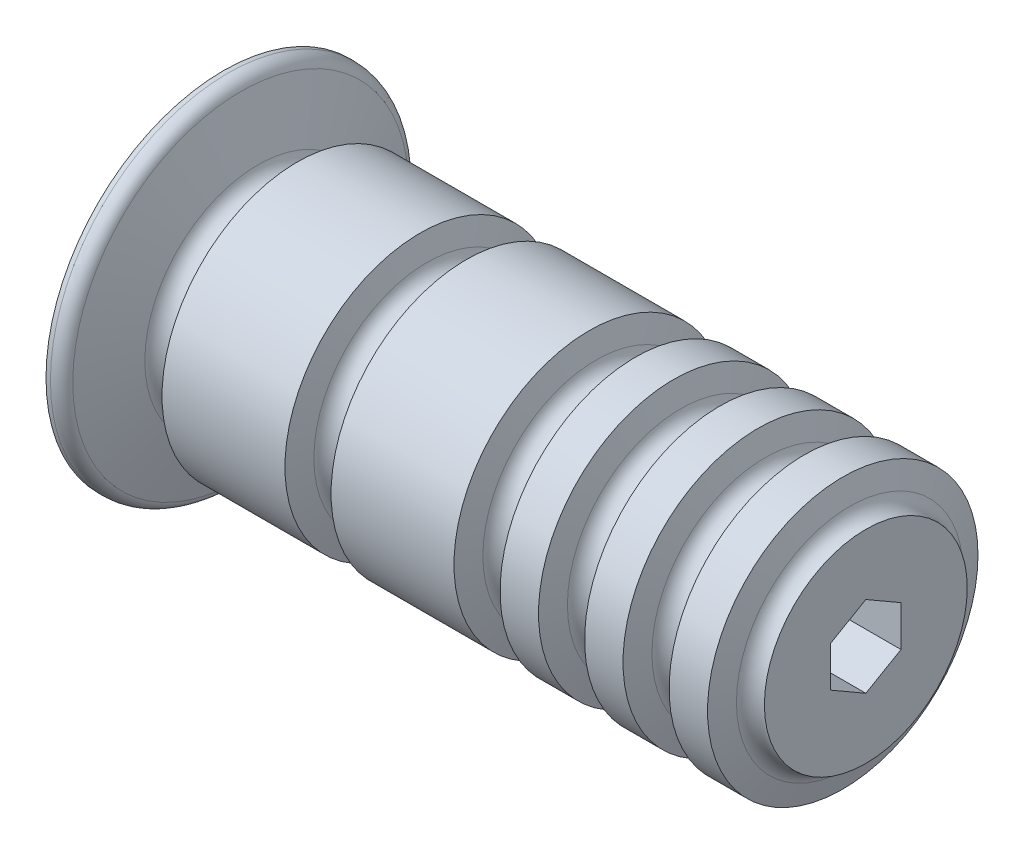
from build123d import *

# Parameters (mm, degrees)
SKETCH1_W          = 120.65
SKETCH1_H          = 25.4
CUT_EXTRUDE1_DEPTH = 126.88384527


# Read off the part's stored shape, not the designer's step: Revolve2
with BuildPart() as part:
    # Sketch1 → Revolve1 (revolve)
    with BuildSketch(Plane.XY, mode=Mode.PRIVATE) as revolve1_sk:
        with Locations((60.325, 12.7)):
            Rectangle(SKETCH1_W, SKETCH1_H)
    revolve(revolve1_sk.sketch.rotate(Axis((0, 0, 0), (-1, 0, 0)), 90), axis=Axis((0, 0, 0), (-1, 0, 0)))

    # Sketch2 → Cut-Revolve1 (revolve, cut)
    with BuildSketch(Plane.XY, mode=Mode.PRIVATE) as cut_revolve1_sk:
        with BuildLine():
            Line((5.194846373, 25.4), (6.496948681, 21.270259087))
            ThreePointArc((6.496948681, 21.270259087), (9.525, 19.05), (12.553051319, 21.270259087))
            Line((12.553051319, 21.270259087), (13.855153627, 25.4))
            Line((13.855153627, 25.4), (5.194846373, 25.4))
        make_face()
        with BuildLine():
            Line((36.944846373, 25.4), (38.246948681, 21.270259087))
            ThreePointArc((38.246948681, 21.270259087), (41.275, 19.05), (44.303051319, 21.270259087))
            Line((44.303051319, 21.270259087), (45.605153627, 25.4))
            Line((45.605153627, 25.4), (36.944846373, 25.4))
        make_face()
        with BuildLine():
            Line((68.694846373, 25.4), (69.996948681, 21.270259087))
            ThreePointArc((69.996948681, 21.270259087), (73.025, 19.05), (76.053051319, 21.270259087))
            Line((76.053051319, 21.270259087), (77.355153627, 25.4))
            Line((77.355153627, 25.4), (68.694846373, 25.4))
        make_face()
        with BuildLine():
            Line((100.444846373, 25.4), (101.746948681, 21.270259087))
            ThreePointArc((101.746948681, 21.270259087), (104.775, 19.05), (107.803051319, 21.270259087))
            Line((107.803051319, 21.270259087), (109.105153627, 25.4))
            Line((109.105153627, 25.4), (100.444846373, 25.4))
        make_face()
    revolve(cut_revolve1_sk.sketch.rotate(Axis((0, 0, 0), (-1, 0, 0)), 90), axis=Axis((0, 0, 0), (-1, 0, 0)), mode=Mode.SUBTRACT)

    # Sketch3 → Cut-Extrude1 (cut, through all)
    with BuildSketch(Plane.ZY):
        Polygon((0, 7.625642355), (-6.604, 3.812821178), (-6.604, -3.812821178), (0, -7.625642355), (6.604, -3.812821178), (6.604, 3.812821178), align=None)
    extrude(amount=-CUT_EXTRUDE1_DEPTH, mode=Mode.SUBTRACT)

    # Sketch4 → Cut-Revolve2 (revolve, cut)
    with BuildSketch(Plane.XY, mode=Mode.PRIVATE) as cut_revolve2_sk:
        with BuildLine():
            Line((116.319846373, 25.4), (117.621948681, 21.270259087))
            ThreePointArc((117.621948681, 21.270259087), (120.65, 19.05), (123.678051319, 21.270259087))
            Line((123.678051319, 21.270259087), (124.980153627, 25.4))
            Line((124.980153627, 25.4), (116.319846373, 25.4))
        make_face()
        with BuildLine():
            Line((84.569846373, 25.4), (85.871948681, 21.270259087))
            ThreePointArc((85.871948681, 21.270259087), (88.9, 19.05), (91.928051319, 21.270259087))
            Line((91.928051319, 21.270259087), (93.230153627, 25.4))
            Line((93.230153627, 25.4), (84.569846373, 25.4))
        make_face()
    revolve(cut_revolve2_sk.sketch.rotate(Axis((0, 0, 0), (-1, 0, 0)), 90), axis=Axis((0, 0, 0), (-1, 0, 0)), mode=Mode.SUBTRACT)

    # Revolve2 outline → Revolve2 (revolve)
    with BuildSketch(Plane.YX):
        with BuildLine():
            Line((25.4, 5.194846373), (25.4, 0))
            Line((25.4, 0), (33.3375, 0))
            Line((33.3375, 0), (33.3375, 0.829757182))
            ThreePointArc((33.3375, 0.829757182), (32.845869295, 2.331683689), (31.561292731, 3.252198237))
            Line((31.561292731, 3.252198237), (25.4, 5.194846373))
        make_face()
    revolve(axis=Axis((0, 0, 0), (1, 0, 0)))


solid = part.part
